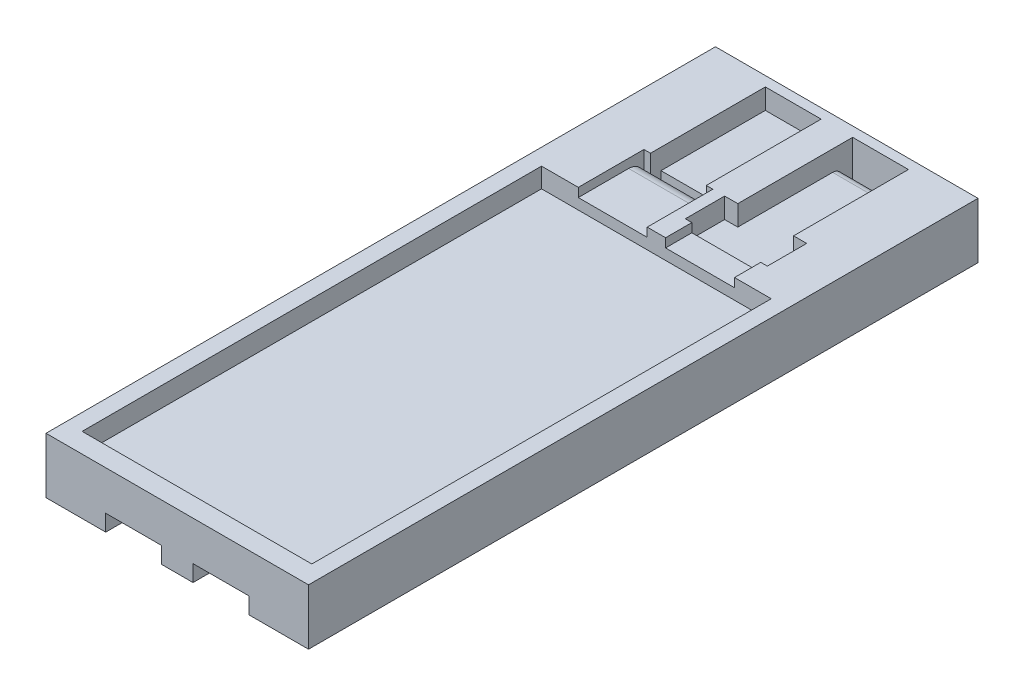
from build123d import *

# Parameters (mm, degrees)
SKETCH1_W               = 40
SKETCH1_H               = 102
BOSS_EXTRUDE1_DEPTH     = 8.5
SKETCH2_W               = 35
SKETCH2_H               = 70
CUT_EXTRUDE1_DEPTH      = 3
SKETCH3_W               = 10.5
SKETCH3_H               = 10
CUT_EXTRUDE2_DEPTH      = 1.35
SKETCH4_W               = 12.5
SKETCH4_H               = 6
CUT_EXTRUDE3_DEPTH      = 3.1
SKETCH5_W               = 8.5
SKETCH5_H               = 17.5
PCB_PLACE_DEPTH         = 3.1
SKETCH6_W               = 8.5
SKETCH6_H               = 1.6
NICKEL_STRIP_HOLE_DEPTH = 66.369411807
CUT_EXTRUDE4_REACH      = 67.698
SKETCH7_W               = 8.5
SKETCH7_H               = 17.5
SKETCH8_W               = 8.5
SKETCH8_H               = 1.6
CUT_EXTRUDE5_DEPTH      = 10
SKETCH9_W               = 8.5
SKETCH9_H               = 102
NICKEL_STRIP_RAIL_DEPTH = 2.5
FILLET3_R               = 2.325
FILLET4_RADIUS          = 1.45
FILLET4_LENGTH          = 8.5


with BuildPart() as part:
    # Sketch1 → Boss-Extrude1 (new body)
    with BuildSketch(Plane(origin=(0, 0, 0), x_dir=(1, 0, 0), z_dir=(0, 1, 0))):
        with Locations((0, 11)):
            Rectangle(SKETCH1_W, SKETCH1_H)
    extrude(amount=BOSS_EXTRUDE1_DEPTH)

    # Sketch2 → Cut-Extrude1 (cut)
    with BuildSketch(Plane(origin=(0, 8.5, 0), x_dir=(1, 0, 0), z_dir=(0, 1, 0))):
        with Locations((0, -2)):
            Rectangle(SKETCH2_W, SKETCH2_H)
    extrude(amount=-CUT_EXTRUDE1_DEPTH, mode=Mode.SUBTRACT)

    # Sketch3 → Cut-Extrude2 (cut)
    with BuildSketch(Plane(origin=(0, 8.5, 0), x_dir=(1, 0, 0), z_dir=(0, 1, 0))):
        with Locations((-6.65, 38)):
            Rectangle(SKETCH3_W, SKETCH3_H)
        with Locations((6.65, 38)):
            Rectangle(SKETCH3_W, SKETCH3_H)
    extrude(amount=-CUT_EXTRUDE2_DEPTH, mode=Mode.SUBTRACT)

    # Sketch4 → Cut-Extrude3 (cut)
    with BuildSketch(Plane(origin=(0, 8.5, 0), x_dir=(1, 0, 0), z_dir=(0, 1, 0))):
        with Locations((6.65, 40)):
            Rectangle(SKETCH4_W, SKETCH4_H)
    extrude(amount=-CUT_EXTRUDE3_DEPTH, mode=Mode.SUBTRACT)

    # Sketch5 → PCB place (cut)
    with BuildSketch(Plane(origin=(0, 8.5, 0), x_dir=(1, 0, 0), z_dir=(0, 1, 0))):
        with Locations((6.65, 51.75)):
            Rectangle(SKETCH5_W, SKETCH5_H)
    extrude(amount=-PCB_PLACE_DEPTH, mode=Mode.SUBTRACT)

    # Sketch6 → Nickel strip hole (cut, through all)
    with BuildSketch(Plane(origin=(0, 5.4, 0), x_dir=(1, 0, 0), z_dir=(0, 1, 0))):
        with Locations((6.65, 59.7)):
            Rectangle(SKETCH6_W, SKETCH6_H)
    extrude(amount=-NICKEL_STRIP_HOLE_DEPTH, mode=Mode.SUBTRACT)

    # Cut-Extrude4: up to this face of the body (flat: up to its plane)
    cut_extrude4_end = Plane(part.part.faces().sort_by_distance((6.65, 5.4, -47.042077088))[0])
    # Sketch7 → Cut-Extrude4 (cut, up to the picked face)
    with BuildSketch(Plane(origin=(0, 8.5, 0), x_dir=(1, 0, 0), z_dir=(0, 1, 0)), mode=Mode.PRIVATE) as cut_extrude4_sk1:
        with Locations((-6.65, 51.75)):
            Rectangle(SKETCH7_W, SKETCH7_H)
    cut_extrude4_tool1 = split(extrude(cut_extrude4_sk1.sketch, amount=-CUT_EXTRUDE4_REACH, mode=Mode.PRIVATE), bisect_by=cut_extrude4_end, keep=Keep.BOTH, mode=Mode.PRIVATE)
    add(cut_extrude4_tool1.solids().sort_by(Axis((-6.65, 8.5, -51.75), (0, -1, 0)))[0], mode=Mode.SUBTRACT)

    # Sketch8 → Cut-Extrude5 (cut)
    with BuildSketch(Plane(origin=(0, 5.4, 0), x_dir=(1, 0, 0), z_dir=(0, 1, 0))):
        with Locations((-6.65, 43.8)):
            Rectangle(SKETCH8_W, SKETCH8_H)
    extrude(amount=-CUT_EXTRUDE5_DEPTH, mode=Mode.SUBTRACT)

    # Sketch9 → Nickel strip rail (cut)
    with BuildSketch(Plane.XZ):
        with Locations((-6.65, -11)):
            Rectangle(SKETCH9_W, SKETCH9_H)
        with Locations((6.65, -11)):
            Rectangle(SKETCH9_W, SKETCH9_H)
    extrude(amount=-NICKEL_STRIP_RAIL_DEPTH, mode=Mode.SUBTRACT)

    # Fillet3
    # the kernel refuses this fillet: 2.325 mm, written as the material it takes off along each edge
    with BuildSketch(Plane(origin=(3.4125, 7.15, -43), x_dir=(0, 0, 1), z_dir=(-1, 0, 0))) as fillet3_piece_1_section:
        with BuildLine():
            CenterArc((FILLET3_R, -FILLET3_R), FILLET3_R, 90, 90)
            Line((0, -FILLET3_R), (0, 0))
            Line((0, 0), (FILLET3_R, 0))
        make_face()
    fillet3_piece_1 = extrude(amount=20.125, mode=Mode.PRIVATE)
    fillet3_piece_1 = split(fillet3_piece_1, bisect_by=Plane(origin=(-11.9, 6.647157341, -42.474696814), z_dir=(1, 0, 0)), keep=Keep.TOP, mode=Mode.PRIVATE)
    fillet3_piece_1 = split(fillet3_piece_1, bisect_by=Plane(origin=(-1.4, 6.647157341, -42.474696814), z_dir=(-1, 0, 0)), keep=Keep.TOP, mode=Mode.PRIVATE)
    add(fillet3_piece_1, mode=Mode.SUBTRACT)
    with BuildSketch(Plane(origin=(-10.9, 2.5, -43), x_dir=(0, 1, 0), z_dir=(1, 0, 0))) as fillet3_piece_2:
        with BuildLine():
            CenterArc((FILLET3_R, FILLET3_R), FILLET3_R, 180, 90)
            Line((0, FILLET3_R), (0, 0))
            Line((0, 0), (FILLET3_R, 0))
        make_face()
    extrude(amount=8.5, mode=Mode.SUBTRACT)

    # Fillet4: full round fillet: the end face becomes a half cylinder, R = half its width
    fillet4_face = Plane((6.65, 3.95, -58.9), x_dir=(-1, 0, 0), z_dir=(0, 0, -1))  # on the end face: x along it, z out of the body
    fillet4_slab = fillet4_face.offset(-FILLET4_RADIUS / 2) * Box(FILLET4_LENGTH, 2 * FILLET4_RADIUS, FILLET4_RADIUS, mode=Mode.PRIVATE)  # the body's end, R deep
    fillet4_round = Plane((6.65, 3.95, -57.45), x_dir=(0, 0, -1), z_dir=(-1, 0, 0)) * Cylinder(FILLET4_RADIUS, FILLET4_LENGTH, mode=Mode.PRIVATE)  # its axis R under the face
    add(fillet4_slab - fillet4_round, mode=Mode.SUBTRACT)


solid = part.part
